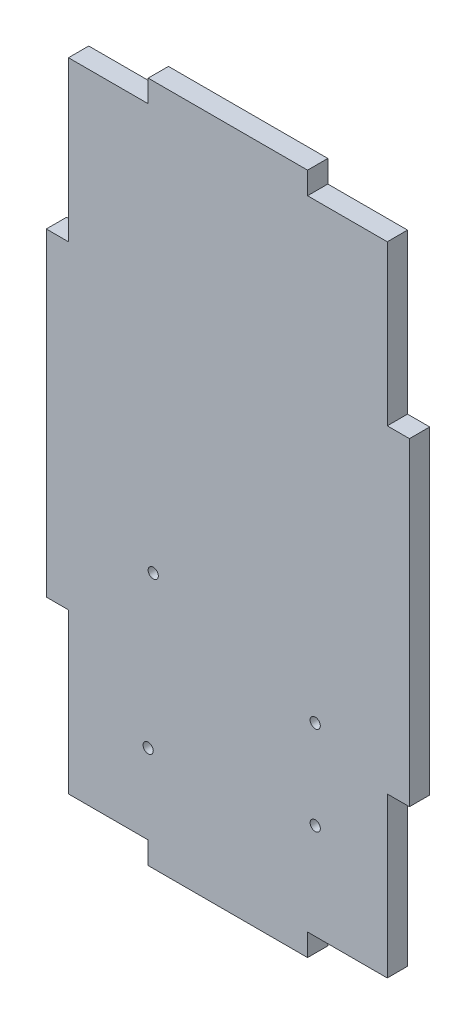
from build123d import *

# Parameters (mm, degrees)
SKETCH1_W                = 100
SKETCH1_H                = 200
BOSS_EXTRUDE1_DEPTH      = 6.36
SKETCH8_W                = 50
SKETCH8_H                = 6.96
BOSS_EXTRUDE4_DEPTH      = 6.36
SKETCH9_W                = 6.96
SKETCH9_H                = 100
BOSS_EXTRUDE5_DEPTH      = 6.36
ARDUINO_HOLES_DEPTH      = 122.347982266
ARDUINO_HOLES_DEPTH_BACK = 122.347982266
SKETCH12_R               = 1.6


with BuildPart() as part:
    # Sketch1 → Boss-Extrude1 (new body)
    with BuildSketch(Plane.XY):
        Rectangle(SKETCH1_W, SKETCH1_H)
    extrude(amount=BOSS_EXTRUDE1_DEPTH)

    # Sketch8 → Boss-Extrude4 (add)
    with BuildSketch(Plane(origin=(0, 0, 0), x_dir=(-1, 0, 0), z_dir=(0, 0, -1))):
        with Locations((0, 103.48)):
            Rectangle(SKETCH8_W, SKETCH8_H)
    boss_extrude4 = extrude(amount=-BOSS_EXTRUDE4_DEPTH)

    # Mirror4: Boss-Extrude4 across plane
    add(boss_extrude4.mirror(Plane.ZX))

    # Sketch9 → Boss-Extrude5 (add)
    with BuildSketch(Plane(origin=(0, 0, 0), x_dir=(-1, 0, 0), z_dir=(0, 0, -1))):
        with Locations((53.48, 0)):
            Rectangle(SKETCH9_W, SKETCH9_H)
    boss_extrude5 = extrude(amount=-BOSS_EXTRUDE5_DEPTH)

    # Mirror5: Boss-Extrude5 across plane
    add(boss_extrude5.mirror(Plane(origin=(0, 0, 0), x_dir=(0, 0, 1), z_dir=(1, 0, 0))))

    # Sketch12 → arduino holes (cut, two sides: drawn at the far end of the back side and taken through both)
    with BuildSketch(Plane.XY.offset(6.36).offset(-ARDUINO_HOLES_DEPTH_BACK)):
        with Locations((-25, -75)):
            Circle(SKETCH12_R)
        with Locations((-23.4, -26.7)):
            Circle(SKETCH12_R)
        with Locations((27.4, -69.9)):
            Circle(SKETCH12_R)
        with Locations((27.4, -42)):
            Circle(SKETCH12_R)
    extrude(amount=ARDUINO_HOLES_DEPTH + ARDUINO_HOLES_DEPTH_BACK, mode=Mode.SUBTRACT)


solid = part.part
